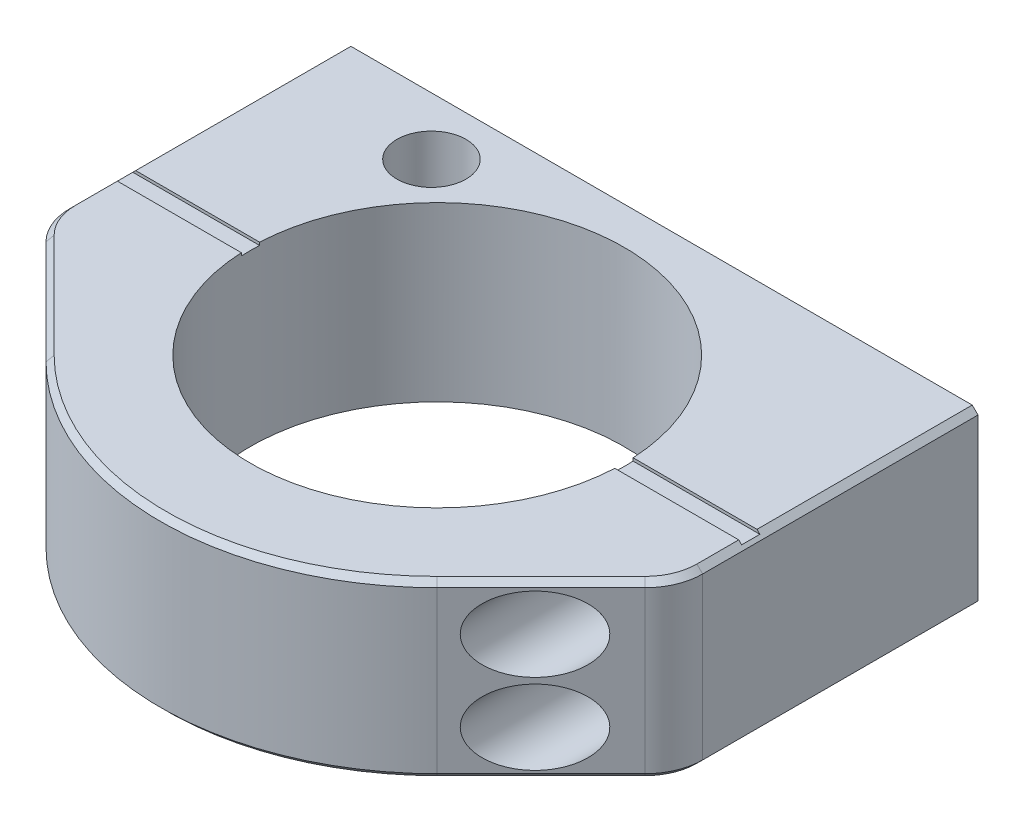
from build123d import *

# Parameters (mm, degrees)
SKETCH1_R               = 32.5
SKETCH1_R_2             = 6
BOSS_EXTRUDE1_DEPTH     = 30
CUT_EXTRUDE1_START      = -0.5
CUT_EXTRUDE1_DEPTH      = 0.5
SKETCH3_R               = 4.5
CUT_EXTRUDE2_DEPTH      = 108.277650829
CUT_EXTRUDE3_DEPTH      = 10
CUT_EXTRUDE3_DEPTH_BACK = 25
SKETCH4_R               = 6.5
FILLET1_R               = 10
CHAMFER1_SIZE           = 1
CHAMFER2_SIZE           = 1


with BuildPart() as part:
    # Sketch1 → Boss-Extrude1 (new body)
    with BuildSketch(Plane(origin=(0, 0, 0), x_dir=(1, 0, 0), z_dir=(0, 1, 0))):
        with BuildLine():
            Line((-34, -23), (-55, -2))
            Line((-55, -2), (-55, 50))
            Line((-55, 50), (55, 50))
            Line((55, 50), (55, -2))
            Line((55, -2), (34, -23))
            ThreePointArc((34, -23), (0, -37.083261121), (-34, -23))
        make_face()
        with Locations((0, 11)):
            Circle(SKETCH1_R, mode=Mode.SUBTRACT)
        with Locations((-30, 40)):
            Circle(SKETCH1_R_2, mode=Mode.SUBTRACT)
    extrude(amount=BOSS_EXTRUDE1_DEPTH)

    # Sketch2 → Cut-Extrude1 (cut)
    with BuildSketch(Plane(origin=(0, 30, 0), x_dir=(1, 0, 0), z_dir=(0, 1, 0)).offset(CUT_EXTRUDE1_START)):
        with BuildLine():
            ThreePointArc((-32.461205211, 9.4125), (-32.5, 11), (-32.461205211, 12.5875))
            Line((-32.461205211, 12.5875), (-55, 12.5875))
            Line((-55, 12.5875), (-55, 9.4125))
            Line((-55, 9.4125), (-32.461205211, 9.4125))
        make_face()
        with BuildLine():
            ThreePointArc((32.461205211, 12.5875), (32.5, 11), (32.461205211, 9.4125))
            Line((32.461205211, 9.4125), (55, 9.4125))
            Line((55, 9.4125), (55, 12.5875))
            Line((55, 12.5875), (32.461205211, 12.5875))
        make_face()
    extrude(amount=CUT_EXTRUDE1_DEPTH, mode=Mode.SUBTRACT)

    # Sketch3 → Cut-Extrude2 (cut, through all)
    with BuildSketch(Plane(origin=(0, 0, -50), x_dir=(-1, 0, 0), z_dir=(0, 0, -1))):
        with Locations((42.5, 8)):
            Circle(SKETCH3_R)
        with Locations((-42.5, 8)):
            Circle(SKETCH3_R)
        with Locations((-42.5, 22)):
            Circle(SKETCH3_R)
        with Locations((42.5, 22)):
            Circle(SKETCH3_R)
    extrude(amount=-CUT_EXTRUDE2_DEPTH, mode=Mode.SUBTRACT)

    # Sketch4 → Cut-Extrude3 (cut, two sides: drawn at the far end of the back side and taken through both)
    with BuildSketch(Plane(origin=(0, 0, 10), x_dir=(-1, 0, 0), z_dir=(0, 0, -1)).offset(-CUT_EXTRUDE3_DEPTH_BACK)):
        with Locations((-42.5, 22)):
            Circle(SKETCH4_R)
        with Locations((-42.5, 8)):
            Circle(SKETCH4_R)
        with Locations((42.5, 8)):
            Circle(SKETCH4_R)
        with Locations((42.5, 22)):
            Circle(SKETCH4_R)
    extrude(amount=CUT_EXTRUDE3_DEPTH + CUT_EXTRUDE3_DEPTH_BACK, mode=Mode.SUBTRACT)

    # Fillet1
    fillet1_edges = [part.edges().sort_by_distance(p)[0] for p in [
        (-55, 15, 2),
        (55, 15, 2),
    ]]
    fillet(fillet1_edges, radius=FILLET1_R)

    # Chamfer1
    chamfer1_edges = [part.edges().sort_by_distance(p)[0] for p in [
        (43.035533906, 30, 13.964466094),
        (54.238795325, 30, 1.6846987),
        (0, 30, 37.083261121),
        (55, 30, -5.777317812),
        (-43.035533906, 30, 13.964466094),
        (-54.238795325, 30, 1.6846987),
        (-55, 30, -5.777317812),
    ]]
    chamfer(chamfer1_edges, length=CHAMFER1_SIZE)

    # Chamfer2
    chamfer2_edges = [part.edges().sort_by_distance(p)[0] for p in [
        (55, 0, -26.071067812),
        (43.035533906, 0, 13.964466094),
        (0, 0, 37.083261121),
        (-43.035533906, 0, 13.964466094),
        (-55, 0, -26.071067812),
        (54.238795325, 0, 1.6846987),
        (-54.238795325, 0, 1.6846987),
    ]]
    chamfer(chamfer2_edges, length=CHAMFER2_SIZE)


solid = part.part
